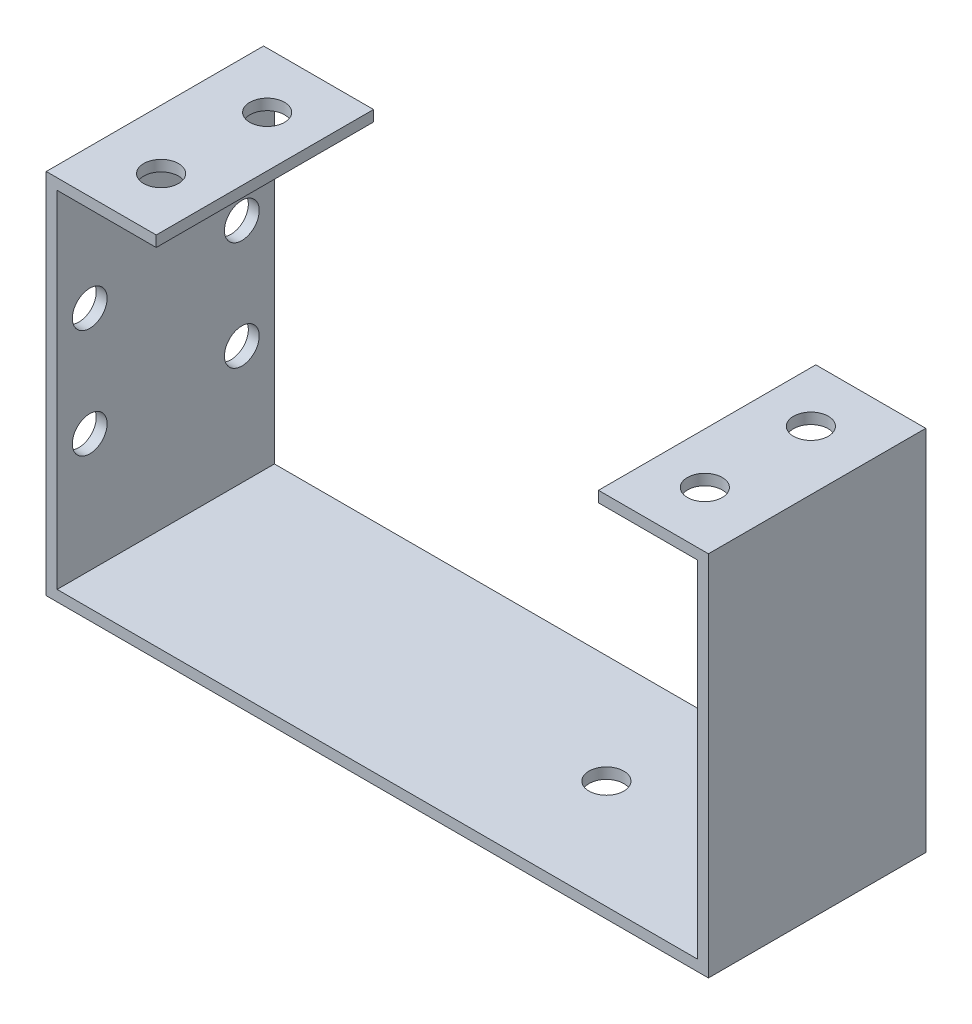
from build123d import *

# Parameters (mm, degrees)
SKETCH_2_W           = 60.94
SKETCH_2_H           = 20
EXTRUDE_1_DEPTH      = 1
SKETCH_3_W           = 1
SKETCH_3_H           = 20
EXTRUDE_2_DEPTH      = 32.81
SKETCH_4_W           = 1
SKETCH_4_H           = 20
EXTRUDE_3_DEPTH      = 32.81
SKETCH_9_W           = 20
SKETCH_9_H           = 1
EXTRUDE_8_DEPTH      = 9.12
SKETCH_10_W          = 20
SKETCH_10_H          = 1
EXTRUDE_9_DEPTH      = 9.12
SKETCH_13_R          = 1.6
CUT_EXTRUDE_2_DEPTH  = 1
SKETCH_14_R          = 1.6
CUT_EXTRUDE_3_DEPTH  = 1
SKETCH_15_R          = 1.6
CUT_EXTRUDE_4_DEPTH  = 1
SKETCH_16_R          = 1.6
CUT_EXTRUDE_5_DEPTH  = 1
SKETCH_17_R          = 1.6
CUT_EXTRUDE_6_DEPTH  = 1
SKETCH_19_R          = 1.6
CUT_EXTRUDE_7_DEPTH  = 1
SKETCH_20_R          = 1.6
CUT_EXTRUDE_8_DEPTH  = 1
SKETCH_22_R          = 1.6
CUT_EXTRUDE_9_DEPTH  = 1
SKETCH_23_R          = 1.6
CUT_EXTRUDE_10_DEPTH = 1


with BuildPart() as part:
    # ｽｹｯﾁ2 → ﾎﾞｽ - 押し出し1 (new body)
    with BuildSketch(Plane(origin=(0, 0, 0), x_dir=(1, 0, 0), z_dir=(0, 1, 0))):
        with Locations((30.47, 10)):
            Rectangle(SKETCH_2_W, SKETCH_2_H)
    extrude(amount=EXTRUDE_1_DEPTH)

    # ｽｹｯﾁ3 → ﾎﾞｽ - 押し出し2 (add)
    with BuildSketch(Plane(origin=(0, 1, 0), x_dir=(1, 0, 0), z_dir=(0, 1, 0))):
        with Locations((60.44, 10)):
            Rectangle(SKETCH_3_W, SKETCH_3_H)
    extrude(amount=EXTRUDE_2_DEPTH)

    # ｽｹｯﾁ4 → ﾎﾞｽ - 押し出し3 (add)
    with BuildSketch(Plane(origin=(0, 1, 0), x_dir=(1, 0, 0), z_dir=(0, 1, 0))):
        with Locations((0.5, 10)):
            Rectangle(SKETCH_4_W, SKETCH_4_H)
    extrude(amount=EXTRUDE_3_DEPTH)

    # ｽｹｯﾁ9 → ﾎﾞｽ - 押し出し8 (add)
    with BuildSketch(Plane.ZY.offset(-59.94)):
        with Locations((-10, 33.31)):
            Rectangle(SKETCH_9_W, SKETCH_9_H)
    extrude(amount=EXTRUDE_8_DEPTH)

    # ｽｹｯﾁ10 → ﾎﾞｽ - 押し出し9 (add)
    with BuildSketch(Plane(origin=(1, 0, 0), x_dir=(0, 0, -1), z_dir=(1, 0, 0))):
        with Locations((10, 33.31)):
            Rectangle(SKETCH_10_W, SKETCH_10_H)
    extrude(amount=EXTRUDE_9_DEPTH)

    # ｽｹｯﾁ13 → ｶｯﾄ - 押し出し2 (cut)
    with BuildSketch(Plane(origin=(0, 33.81, 0), x_dir=(1, 0, 0), z_dir=(0, 1, 0))):
        with Locations((55.49, 5.12)):
            Circle(SKETCH_13_R)
    extrude(amount=-CUT_EXTRUDE_2_DEPTH, mode=Mode.SUBTRACT)

    # ｽｹｯﾁ14 → ｶｯﾄ - 押し出し3 (cut)
    with BuildSketch(Plane(origin=(0, 33.81, 0), x_dir=(1, 0, 0), z_dir=(0, 1, 0))):
        with Locations((55.49, 14.88)):
            Circle(SKETCH_14_R)
    extrude(amount=-CUT_EXTRUDE_3_DEPTH, mode=Mode.SUBTRACT)

    # ｽｹｯﾁ15 → ｶｯﾄ - 押し出し4 (cut)
    with BuildSketch(Plane(origin=(0, 33.81, 0), x_dir=(1, 0, 0), z_dir=(0, 1, 0))):
        with Locations((5.45, 5.12)):
            Circle(SKETCH_15_R)
    extrude(amount=-CUT_EXTRUDE_4_DEPTH, mode=Mode.SUBTRACT)

    # ｽｹｯﾁ16 → ｶｯﾄ - 押し出し5 (cut)
    with BuildSketch(Plane(origin=(0, 33.81, 0), x_dir=(1, 0, 0), z_dir=(0, 1, 0))):
        with Locations((5.45, 14.88)):
            Circle(SKETCH_16_R)
    extrude(amount=-CUT_EXTRUDE_5_DEPTH, mode=Mode.SUBTRACT)

    # ｽｹｯﾁ17 → ｶｯﾄ - 押し出し6 (cut)
    with BuildSketch(Plane(origin=(0, 0, 0), x_dir=(-1, 0, 0), z_dir=(0, -1, 0))):
        with Locations((-41.55, 10)):
            Circle(SKETCH_17_R)
    extrude(amount=-CUT_EXTRUDE_6_DEPTH, mode=Mode.SUBTRACT)

    # ｽｹｯﾁ19 → ｶｯﾄ - 押し出し7 (cut)
    with BuildSketch(Plane.ZY):
        with Locations((-3, 21.905)):
            Circle(SKETCH_19_R)
    extrude(amount=-CUT_EXTRUDE_7_DEPTH, mode=Mode.SUBTRACT)

    # ｽｹｯﾁ20 → ｶｯﾄ - 押し出し8 (cut)
    with BuildSketch(Plane.ZY):
        with Locations((-17, 21.905)):
            Circle(SKETCH_20_R)
    extrude(amount=-CUT_EXTRUDE_8_DEPTH, mode=Mode.SUBTRACT)

    # ｽｹｯﾁ22 → ｶｯﾄ - 押し出し9 (cut)
    with BuildSketch(Plane.ZY):
        with Locations((-3, 11.905)):
            Circle(SKETCH_22_R)
    extrude(amount=-CUT_EXTRUDE_9_DEPTH, mode=Mode.SUBTRACT)

    # ｽｹｯﾁ23 → ｶｯﾄ - 押し出し10 (cut)
    with BuildSketch(Plane.ZY):
        with Locations((-17, 11.905)):
            Circle(SKETCH_23_R)
    extrude(amount=-CUT_EXTRUDE_10_DEPTH, mode=Mode.SUBTRACT)


solid = part.part
